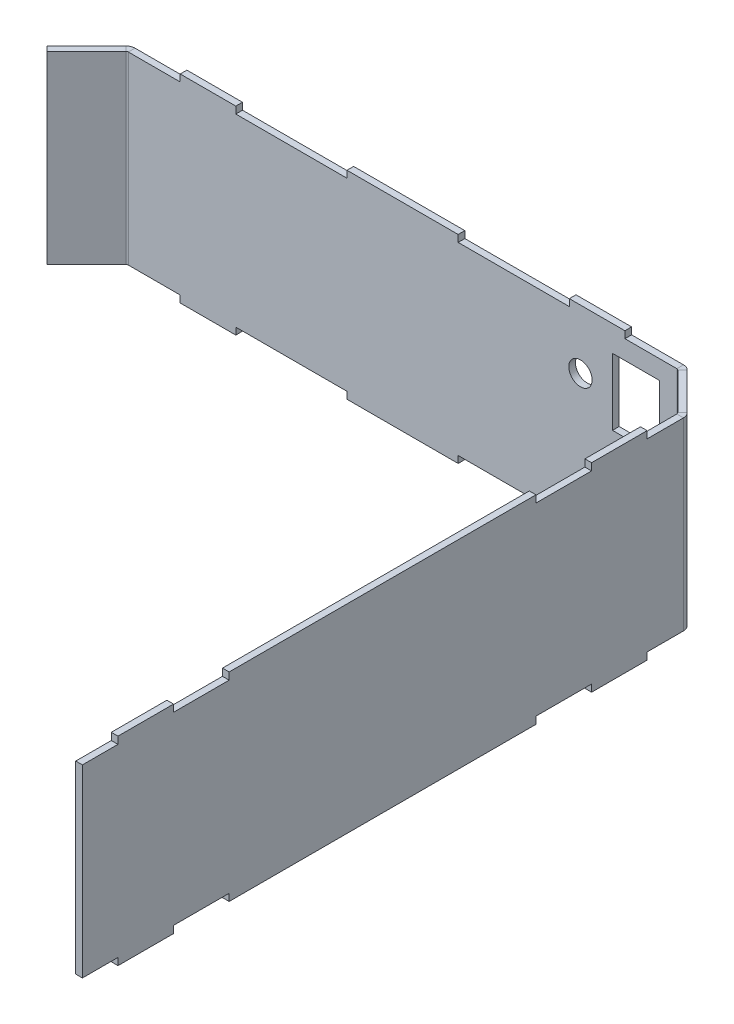
from build123d import *

# Parameters (mm, degrees)
BASE_FLANGE1_DEPTH  = 83
SKETCH2_W           = 50
SKETCH2_H           = 3.1
SKETCH2_W_2         = 25
BOSS_EXTRUDE1_DEPTH = 3
SKETCH3_W           = 138
SKETCH3_H           = 3.2
SKETCH3_W_2         = 25
BOSS_EXTRUDE2_DEPTH = 3
CUT_EXTRUDE1_REACH  = 337.928
SKETCH4_R           = 5.25
SKETCH4_W           = 21.2
SKETCH4_H           = 30


# Sheet-metal steps are written as plain solids
with BuildPart() as part:
    # Sketch1 → Base-Flange1 (new body)
    with BuildSketch(Plane(origin=(0, 0, 0), x_dir=(1, 0, 0), z_dir=(0, 1, 0))):
        with BuildLine():
            Line((-144, 137), (-126.171572875, 154.828427125))
            ThreePointArc((-126.171572875, 154.828427125), (-124.87387948, 155.69551813), (-123.343145751, 156))
            Line((-123.343145751, 156), (123.343145751, 156))
            ThreePointArc((123.343145751, 156), (124.87387948, 155.69551813), (126.171572875, 154.828427125))
            Line((126.171572875, 154.828427125), (142.828427125, 138.171572875))
            ThreePointArc((142.828427125, 138.171572875), (143.69551813, 136.87387948), (144, 135.343145751))
            Line((144, 135.343145751), (144, -135))
            Line((144, -135), (141, -135))
            Line((141, -135), (141, 135.343145751))
            ThreePointArc((141, 135.343145751), (140.923879533, 135.725829183), (140.707106781, 136.050252532))
            Line((140.707106781, 136.050252532), (124.050252532, 152.707106781))
            ThreePointArc((124.050252532, 152.707106781), (123.725829183, 152.923879533), (123.343145751, 153))
            Line((123.343145751, 153), (-123.343145751, 153))
            ThreePointArc((-123.343145751, 153), (-123.725829183, 152.923879533), (-124.050252532, 152.707106781))
            Line((-124.050252532, 152.707106781), (-141.878679656, 134.878679656))
            Line((-141.878679656, 134.878679656), (-144, 137))
        make_face()
    extrude(amount=BASE_FLANGE1_DEPTH)

    # Sketch2 → Boss-Extrude1 (add)
    with BuildSketch(Plane(origin=(0, 0, -156), x_dir=(-1, 0, 0), z_dir=(0, 0, -1))):
        with Locations((0, -1.55)):
            Rectangle(SKETCH2_W, SKETCH2_H)
        with Locations((-87.5, -1.55)):
            Rectangle(SKETCH2_W_2, SKETCH2_H)
        with Locations((87.5, -1.55)):
            Rectangle(SKETCH2_W_2, SKETCH2_H)
    boss_extrude1 = extrude(amount=-BOSS_EXTRUDE1_DEPTH)

    # Sketch3 → Boss-Extrude2 (add)
    with BuildSketch(Plane(origin=(144, 0, 0), x_dir=(0, 0, -1), z_dir=(1, 0, 0))):
        with Locations((0, -1.6)):
            Rectangle(SKETCH3_W, SKETCH3_H)
        with Locations((106.5, -1.6)):
            Rectangle(SKETCH3_W_2, SKETCH3_H)
        with Locations((-106.5, -1.6)):
            Rectangle(SKETCH3_W_2, SKETCH3_H)
    boss_extrude2 = extrude(amount=-BOSS_EXTRUDE2_DEPTH)

    # Mirror1: Boss-Extrude1, Boss-Extrude2 across plane
    add(boss_extrude1.mirror(Plane.ZX.offset(41.5)))
    add(boss_extrude2.mirror(Plane.ZX.offset(41.5)))

    # Sketch4 → Cut-Extrude1 (cut, up to next)
    with BuildSketch(Plane(origin=(0, 0, -156), x_dir=(-1, 0, 0), z_dir=(0, 0, -1)), mode=Mode.PRIVATE) as cut_extrude1_sk1:
        with Locations((-80, 59.5)):
            Circle(SKETCH4_R)
    cut_extrude1_tool1 = extrude(cut_extrude1_sk1.sketch, amount=-CUT_EXTRUDE1_REACH, mode=Mode.PRIVATE) & part.part
    # Sketch4 → Cut-Extrude1 (cut, up to next)
    with BuildSketch(Plane(origin=(0, 0, -156), x_dir=(-1, 0, 0), z_dir=(0, 0, -1)), mode=Mode.PRIVATE) as cut_extrude1_sk2:
        with Locations((-105, 59.5)):
            Rectangle(SKETCH4_W, SKETCH4_H)
    cut_extrude1_tool2 = extrude(cut_extrude1_sk2.sketch, amount=-CUT_EXTRUDE1_REACH, mode=Mode.PRIVATE) & part.part
    add(cut_extrude1_tool1.solids().sort_by_distance((80, 59.5, -156))[0], mode=Mode.SUBTRACT)
    add(cut_extrude1_tool2.solids().sort_by_distance((105, 59.5, -156))[0], mode=Mode.SUBTRACT)


solid = part.part
